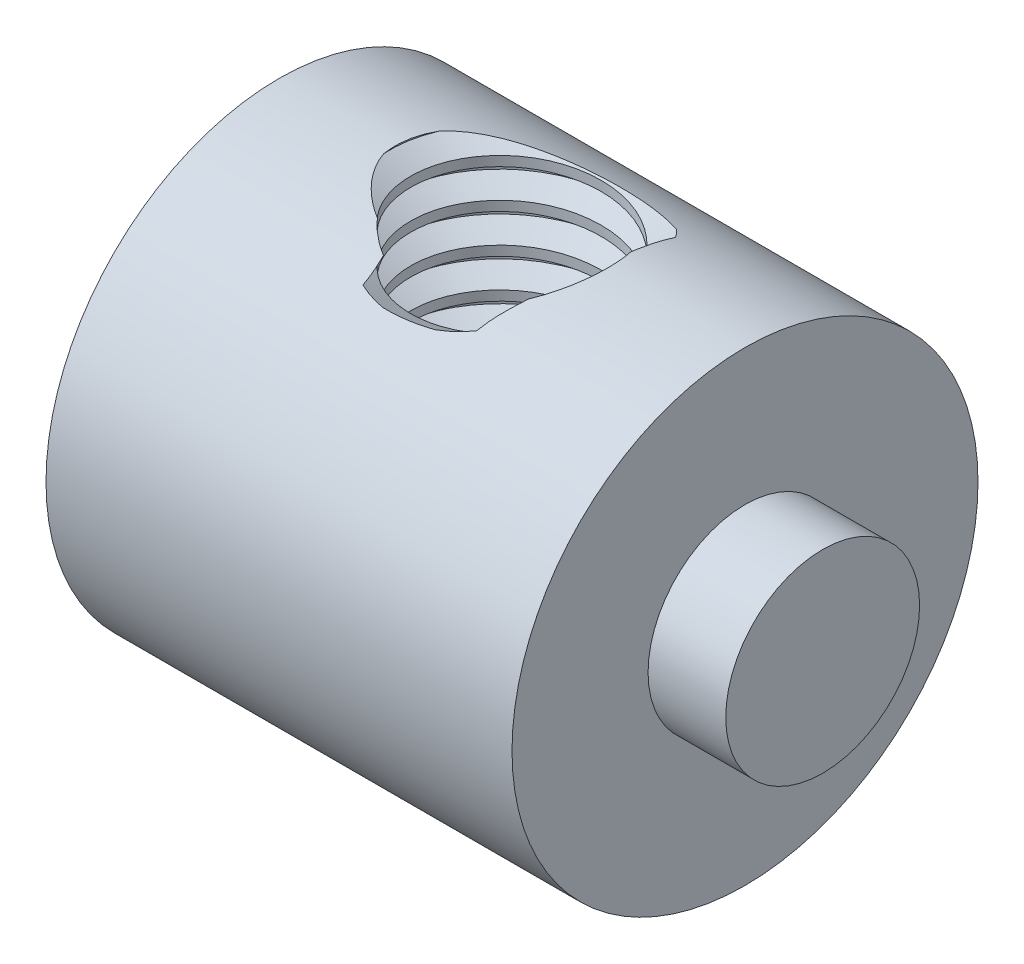
from build123d import *

# Parameters (mm, degrees)
CUT_EXTRUDE1_DEPTH      = 29.750847814
CUT_EXTRUDE1_DEPTH_BACK = 29.750847814
SKETCH2_R               = 4.7625
SKETCH3_R               = 7.699802449
SKETCH3_R_2             = 4.7625
BOSS_EXTRUDE1_DEPTH     = 10.16
THREAD1_PITCH           = 1.5875
SKETCH9_W               = 18.956587891
SKETCH9_H               = 3.425347632


with BuildPart() as part:
    # Sketch1 → Revolve1 (revolve)
    with BuildSketch(Plane.XY, mode=Mode.PRIVATE) as revolve1_sk:
        Polygon((0, 0), (25.4, 0), (25.4, 3.9624), (22.225, 3.9624), (22.225, 9.525), (3.175, 9.525), (3.175, 3.9624), (0, 3.9624), align=None)
    revolve(revolve1_sk.sketch.rotate(Axis((0, 0, 0), (1, 0, 0)), 90), axis=Axis((0, 0, 0), (1, 0, 0)))

    # Sketch2 → Cut-Extrude1 (cut, two sides: drawn at the far end of the back side and taken through both)
    with BuildSketch(Plane(origin=(0, 0, 0), x_dir=(1, 0, 0), z_dir=(0, 1, 0)).offset(-CUT_EXTRUDE1_DEPTH_BACK)):
        with Locations(Location((12.7, 0, 0), (0, 0, 270))):
            Circle(SKETCH2_R)
    extrude(amount=CUT_EXTRUDE1_DEPTH + CUT_EXTRUDE1_DEPTH_BACK, mode=Mode.SUBTRACT)

    # Sketch3 → Boss-Extrude1 (add, symmetric)
    with BuildSketch(Plane(origin=(0, 0, 0), x_dir=(1, 0, 0), z_dir=(0, 1, 0))):
        with Locations(Location((12.7, 0, 0), (0, 0, 90))):
            Circle(SKETCH3_R)
        with Locations(Location((12.7, 0, 0), (0, 0, 270))):
            Circle(SKETCH3_R_2, mode=Mode.SUBTRACT)
    extrude(amount=BOSS_EXTRUDE1_DEPTH, both=True)

    # Thread1: the profile of Thread Profile1 profile screwed along a right-hand helix of 13.8 turns, 8 arcs to a turn; built about Z, then put on its axis
    thread1_z = Axis((0, 0, 0), (0, 0, 1))
    thread1_corners = [(4.7628, 0, -0.000173205), (4.7628, 0, 1.389235701), (3.903240423, 0, 0.892968748), (3.903240423, 0, 0.496093748)]
    with BuildLine(mode=Mode.PRIVATE) as thread1_profile:
        Line(thread1_corners[0], thread1_corners[1])
        Line(thread1_corners[1], thread1_corners[2])
        Line(thread1_corners[2], thread1_corners[3])
        Line(thread1_corners[3], thread1_corners[0])
    thread1_cap = Face(thread1_profile.wire())
    thread1_turn_angles = [0, 22.5, 45, 67.5, 90, 112.5, 135, 157.5, 180, 202.5, 225, 247.5, 270, 292.5, 315, 337.5, 360]
    thread1_turn_weights = [1, 0.9238795325112867, 1, 0.9238795325112867, 1, 0.9238795325112867, 1, 0.9238795325112867, 1, 0.9238795325112867, 1, 0.9238795325112867, 1, 0.9238795325112867, 1, 0.9238795325112867, 1]
    thread1_turn_rails = [Edge.make_bspline([Vector(p[0], p[1], 0).rotate(thread1_z, thread1_turn_angles[k]) / thread1_turn_weights[k] + Vector(0, 0, p[2] + THREAD1_PITCH * thread1_turn_angles[k] / 360) for k in range(17)], [0, 0, 0, 1, 1, 2, 2, 3, 3, 4, 4, 5, 5, 6, 6, 7, 7, 8, 8, 8], 2, thread1_turn_weights) for p in thread1_corners]
    thread1_turn_sides = [Face.make_surface_from_curves(thread1_turn_rails[p[0]], thread1_turn_rails[p[1]]) for p in [(0, 1), (1, 2), (2, 3), (3, 0)]]
    thread1_last_angles = [4680, 4702.5, 4725, 4747.5, 4770, 4792.5, 4815, 4837.5, 4860, 4882.5, 4905, 4927.5, 4950, 4959, 4968]
    thread1_last_weights = [1, 0.9238795325112867, 1, 0.9238795325112867, 1, 0.9238795325112867, 1, 0.9238795325112867, 1, 0.9238795325112867, 1, 0.9238795325112867, 1, 0.9876883405951364, 1]
    thread1_last_rails = [Edge.make_bspline([Vector(p[0], p[1], 0).rotate(thread1_z, thread1_last_angles[k]) / thread1_last_weights[k] + Vector(0, 0, p[2] + THREAD1_PITCH * thread1_last_angles[k] / 360) for k in range(15)], [0, 0, 0, 1, 1, 2, 2, 3, 3, 4, 4, 5, 5, 6, 6, 7, 7, 7], 2, thread1_last_weights) for p in thread1_corners]
    thread1_last_sides = [Face.make_surface_from_curves(thread1_last_rails[p[0]], thread1_last_rails[p[1]]) for p in [(0, 1), (1, 2), (2, 3), (3, 0)]]
    thread1 = Plane(origin=(12.7, -11.7475, 0), x_dir=(1, 0, 0), z_dir=(0, 1, 0)) * Solid(Shell([*[p.moved(Location((0, 0, THREAD1_PITCH * i))) for i in range(13) for p in thread1_turn_sides], *thread1_last_sides, thread1_cap, thread1_cap.rotate(thread1_z, 4968).moved(Location((0, 0, THREAD1_PITCH * 4968 / 360)))]))
    add(thread1)

    # Sketch9 → Cut-Revolve1 (revolve, cut)
    with BuildSketch(Plane.XY):
        with Locations((12.746706055, 11.237673816)):
            Rectangle(SKETCH9_W, SKETCH9_H)
    revolve(axis=Axis((0, 0, 0), (-1, 0, 0)), mode=Mode.SUBTRACT)


solid = part.part
